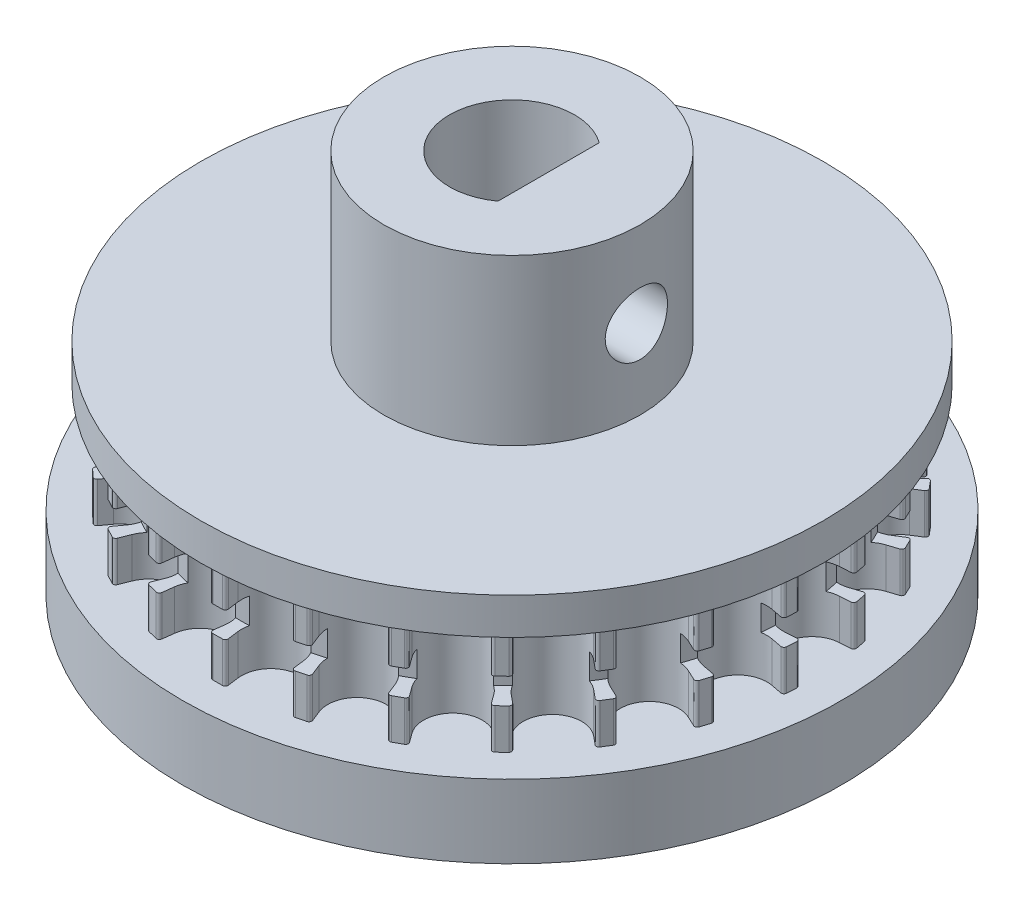
from build123d import *

# Parameters (mm, degrees)
SKETCH1_R           = 18
BOSS_EXTRUDE1_DEPTH = 4
BOSS_EXTRUDE4_DEPTH = 6
SKETCH8_R           = 17
BOSS_EXTRUDE5_DEPTH = 2
SKETCH9_R           = 7
BOSS_EXTRUDE6_DEPTH = 9
CUT_EXTRUDE3_DEPTH  = 34
F_3DSKETCH1_R       = 1.7
CUT_EXTRUDE4_DEPTH  = 9
SKETCH17_R          = 17.01674899
SKETCH17_R_2        = 14.83658427
CUT_EXTRUDE6_DEPTH  = 1.4


with BuildPart() as part:
    # Sketch1 → Boss-Extrude1 (new body)
    with BuildSketch(Plane(origin=(0, 0, 0), x_dir=(1, 0, 0), z_dir=(0, 1, 0))):
        Circle(SKETCH1_R)
    extrude(amount=BOSS_EXTRUDE1_DEPTH)

    # Sketch7 → Boss-Extrude4 (add)
    with BuildSketch(Plane(origin=(0, 4, 0), x_dir=(1, 0, 0), z_dir=(0, 1, 0))):
        with BuildLine():
            Line((2.150018016, 15.28671265), (2.299143935, 15.867519758))
            ThreePointArc((2.299143935, 15.867519758), (2.278294144, 15.98858041), (2.173985961, 16.053466449))
            Line((2.173985961, 16.053466449), (1.646061715, 16.116155895))
            ThreePointArc((1.646061715, 16.116155895), (1.530287316, 16.078256523), (1.480820403, 15.966932229))
            Line((1.480820403, 15.966932229), (1.480820403, 15.3411402))
            ThreePointArc((1.480820403, 15.3411402), (-0.119179597, 13.7411402), (-1.719179597, 15.3411402))
            Line((-1.719179597, 15.3411402), (-1.719179597, 15.940786293))
            ThreePointArc((-1.719179597, 15.940786293), (-1.769480914, 16.052858469), (-1.886648566, 16.089765604))
            Line((-1.886648566, 16.089765604), (-2.413577332, 16.019196124))
            ThreePointArc((-2.413577332, 16.019196124), (-2.516289275, 15.953695509), (-2.536516868, 15.833566751))
            Line((-2.536516868, 15.833566751), (-2.380888719, 15.227435129))
            ThreePointArc((-2.380888719, 15.227435129), (-3.532717957, 13.279798252), (-5.480354834, 14.43162749))
            Line((-5.480354834, 14.43162749), (-5.629480753, 15.012434598))
            ThreePointArc((-5.629480753, 15.012434598), (-5.706072979, 15.108476392), (-5.828738024, 15.115085612))
            Line((-5.828738024, 15.115085612), (-6.321562438, 14.915691346))
            ThreePointArc((-6.321562438, 14.915691346), (-6.404758156, 14.826705131), (-6.394475455, 14.705320042))
            Line((-6.394475455, 14.705320042), (-6.092997846, 14.156934306))
            ThreePointArc((-6.092997846, 14.156934306), (-6.724282655, 11.98403774), (-8.897179222, 12.615322549))
            Line((-8.897179222, 12.615322549), (-9.18606093, 13.140796426))
            ThreePointArc((-9.18606093, 13.140796426), (-9.284131493, 13.214773178), (-9.404586436, 13.190669201))
            Line((-9.404586436, 13.190669201), (-9.832340528, 12.874978825))
            ThreePointArc((-9.832340528, 12.874978825), (-9.890792527, 12.768098342), (-9.850645632, 12.653083992))
            Line((-9.850645632, 12.653083992), (-9.422261509, 12.196901236))
            ThreePointArc((-9.422261509, 12.196901236), (-9.493335944, 9.935276062), (-11.754961117, 10.006350497))
            Line((-11.754961117, 10.006350497), (-12.165447114, 10.443473686))
            ThreePointArc((-12.165447114, 10.443473686), (-12.27883388, 10.490737165), (-12.389510095, 10.437434532))
            Line((-12.389510095, 10.437434532), (-12.725316501, 10.025284033))
            ThreePointArc((-12.725316501, 10.025284033), (-12.755352028, 9.907224976), (-12.687863516, 9.805808141))
            Line((-12.687863516, 9.805808141), (-12.15948983, 9.470492003))
            ThreePointArc((-12.15948983, 9.470492003), (-11.665888021, 7.262244451), (-13.874135574, 6.768642642))
            Line((-13.874135574, 6.768642642), (-14.380433515, 7.089949086))
            ThreePointArc((-14.380433515, 7.089949086), (-14.502011976, 7.107529554), (-14.595955268, 7.028377466))
            Line((-14.595955268, 7.028377466), (-14.818714038, 6.545663776))
            ThreePointArc((-14.818714038, 6.545663776), (-14.81844585, 6.423844229), (-14.727856272, 6.3423973))
            Line((-14.727856272, 6.3423973), (-14.132692685, 6.149016928))
            ThreePointArc((-14.132692685, 6.149016928), (-13.10542945, 4.132899311), (-15.121547067, 3.105636076))
            Line((-15.121547067, 3.105636076), (-15.691844391, 3.290936909))
            ThreePointArc((-15.691844391, 3.290936909), (-15.813975326, 3.277729721), (-15.885282892, 3.177701595))
            Line((-15.885282892, 3.177701595), (-15.980997272, 2.654755389))
            ThreePointArc((-15.980997272, 2.654755389), (-15.950442221, 2.536829723), (-15.842443653, 2.480470312))
            Line((-15.842443653, 2.480470312), (-15.217886482, 2.441176505))
            ThreePointArc((-15.217886482, 2.441176505), (-13.721508548, 0.743868908), (-15.418816144, -0.752509026))
            Line((-15.418816144, -0.752509026), (-16.017278972, -0.714856936))
            ThreePointArc((-16.017278972, -0.714856936), (-16.132288445, -0.758021925), (-16.17647977, -0.872640954))
            Line((-16.17647977, -0.872640954), (-16.139135674, -1.402961041))
            ThreePointArc((-16.139135674, -1.402961041), (-16.080213646, -1.509583124), (-15.961592036, -1.537313749))
            Line((-15.961592036, -1.537313749), (-15.346884504, -1.420052016))
            ThreePointArc((-15.346884504, -1.420052016), (-13.475414799, -2.691901514), (-14.747264297, -4.563371218))
            Line((-14.747264297, -4.563371218), (-15.336289009, -4.675733691))
            ThreePointArc((-15.336289009, -4.675733691), (-15.436950552, -4.746144265), (-15.451248932, -4.868152263))
            Line((-15.451248932, -4.868152263), (-15.283192826, -5.37252427))
            ThreePointArc((-15.283192826, -5.37252427), (-15.199606108, -5.461143311), (-15.077814888, -5.458502733))
            Line((-15.077814888, -5.458502733), (-14.511581331, -5.192053446))
            ThreePointArc((-14.511581331, -5.192053446), (-12.38261118, -5.958529864), (-13.149087598, -8.087500014))
            Line((-13.149087598, -8.087500014), (-13.691663604, -8.342816903))
            ThreePointArc((-13.691663604, -8.342816903), (-13.771652282, -8.436048907), (-13.755159297, -8.557779661))
            Line((-13.755159297, -8.557779661), (-13.466950765, -9.00451204))
            ThreePointArc((-13.466950765, -9.00451204), (-13.363951418, -9.069559779), (-13.246643178, -9.036713915))
            Line((-13.246643178, -9.036713915), (-12.764462133, -8.637819063))
            ThreePointArc((-12.764462133, -8.637819063), (-10.511762561, -8.850761868), (-10.724705365, -11.10346144))
            Line((-10.724705365, -11.10346144), (-11.186740621, -11.485690245))
            ThreePointArc((-11.186740621, -11.485690245), (-11.24103045, -11.595885569), (-11.194782415, -11.70969029))
            Line((-11.194782415, -11.70969029), (-10.80453066, -12.070713203))
            ThreePointArc((-10.80453066, -12.070713203), (-10.688590511, -12.108102451), (-10.58313616, -12.047115128))
            Line((-10.58313616, -12.047115128), (-10.215304834, -11.540838741))
            ThreePointArc((-10.215304834, -11.540838741), (-7.98042124, -11.186867954), (-7.626450452, -13.421751548))
            Line((-7.626450452, -13.421751548), (-7.978913582, -13.906875428))
            ThreePointArc((-7.978913582, -13.906875428), (-8.004093334, -14.027110095), (-7.930996183, -14.125838012))
            Line((-7.930996183, -14.125838012), (-7.463222157, -14.378467062))
            ThreePointArc((-7.463222157, -14.378467062), (-7.341626153, -14.385848516), (-7.254651775, -14.30055179))
            Line((-7.254651775, -14.30055179), (-7.024282364, -13.718705076))
            ThreePointArc((-7.024282364, -13.718705076), (-4.947640702, -12.820061983), (-4.048997609, -14.896703645))
            Line((-4.048997609, -14.896703645), (-4.269742059, -15.454240482))
            ThreePointArc((-4.269742059, -15.454240482), (-4.264229597, -15.576959706), (-4.168876292, -15.654407381))
            Line((-4.168876292, -15.654407381), (-3.652971957, -15.782768955))
            ThreePointArc((-3.652971957, -15.782768955), (-3.533360423, -15.759678811), (-3.470330938, -15.65543219))
            Line((-3.470330938, -15.65543219), (-3.391898399, -15.034574718))
            ThreePointArc((-3.391898399, -15.034574718), (-1.603981703, -13.64772437), (-0.217131355, -15.435641065))
            Line((-0.217131355, -15.435641065), (-0.292286939, -16.03055877))
            ThreePointArc((-0.292286939, -16.03055877), (-0.256428631, -16.14805165), (-0.144810572, -16.199352762))
            Line((-0.144810572, -16.199352762), (0.386807904, -16.195381429))
            ThreePointArc((0.386807904, -16.195381429), (0.496919337, -16.143270526), (0.532043555, -16.026624209))
            Line((0.532043555, -16.026624209), (0.453611016, -15.405766737))
            ThreePointArc((0.453611016, -15.405766737), (1.840461365, -13.617850041), (3.628378061, -15.004700389))
            Line((3.628378061, -15.004700389), (3.703533644, -15.599618094))
            ThreePointArc((3.703533644, -15.599618094), (3.767484689, -15.70450212), (3.888354129, -15.726433231))
            Line((3.888354129, -15.726433231), (4.402283203, -15.590378527))
            ThreePointArc((4.402283203, -15.590378527), (4.495975828, -15.512521183), (4.500987794, -15.390804487))
            Line((4.500987794, -15.390804487), (4.270618384, -14.808957773))
            ThreePointArc((4.270618384, -14.808957773), (5.169261477, -12.732316111), (7.245903138, -13.630959204))
            Line((7.245903138, -13.630959204), (7.466647588, -14.188496041))
            ThreePointArc((7.466647588, -14.188496041), (7.55467309, -14.274180965), (7.677199239, -14.265364063))
            Line((7.677199239, -14.265364063), (8.141146858, -14.005774803))
            ThreePointArc((8.141146858, -14.005774803), (8.212533622, -13.907063083), (8.187118417, -13.787923915))
            Line((8.187118417, -13.787923915), (7.819287092, -13.281647529))
            ThreePointArc((7.819287092, -13.281647529), (8.173257879, -11.046763934), (10.408141474, -11.400734722))
            Line((10.408141474, -11.400734722), (10.760604604, -11.885858601))
            ThreePointArc((10.760604604, -11.885858601), (10.867173596, -11.946960524), (10.983657687, -11.907949606))
            Line((10.983657687, -11.907949606), (11.368472314, -11.54113674))
            ThreePointArc((11.368472314, -11.54113674), (11.413067726, -11.427773063), (11.35882228, -11.318697376))
            Line((11.35882228, -11.318697376), (10.876641234, -10.919802524))
            ThreePointArc((10.876641234, -10.919802524), (10.663698429, -8.667102952), (12.916398001, -8.454160147))
            Line((12.916398001, -8.454160147), (13.378433257, -8.836388952))
            ThreePointArc((13.378433257, -8.836388952), (13.496849619, -8.869068615), (13.599972527, -8.802314881))
            Line((13.599972527, -8.802314881), (13.881474845, -8.351326609))
            ThreePointArc((13.881474845, -8.351326609), (13.89647681, -8.230434033), (13.816809564, -8.138275453))
            Line((13.816809564, -8.138275453), (13.250576007, -7.871826166))
            ThreePointArc((13.250576007, -7.871826166), (12.484099589, -5.742856016), (14.61306974, -4.976379598))
            Line((14.61306974, -4.976379598), (15.155645746, -5.231696487))
            ThreePointArc((15.155645746, -5.231696487), (15.278468942, -5.233900506), (15.361751076, -5.14359834))
            Line((15.361751076, -5.14359834), (15.522253258, -4.636771914))
            ThreePointArc((15.522253258, -4.636771914), (15.506719148, -4.515946564), (15.406635888, -4.446495753))
            Line((15.406635888, -4.446495753), (14.791928356, -4.32923402))
            ThreePointArc((14.791928356, -4.32923402), (13.520078859, -2.457764316), (15.391548563, -1.185914818))
            Line((15.391548563, -1.185914818), (15.980573275, -1.298277291))
            ThreePointArc((15.980573275, -1.298277291), (16.100085871, -1.26986718), (16.158294308, -1.161690598))
            Line((16.158294308, -1.161690598), (16.187711413, -0.630871787))
            ThreePointArc((16.187711413, -0.630871787), (16.142617292, -0.517705563), (16.028406618, -0.475326372))
            Line((16.028406618, -0.475326372), (15.403849447, -0.514620178))
            ThreePointArc((15.403849447, -0.514620178), (13.70654185, 0.981757756), (15.202919784, 2.679065353))
            Line((15.202919784, 2.679065353), (15.801382612, 2.716717442))
            ThreePointArc((15.801382612, 2.716717442), (15.910075194, 2.773956571), (15.939552483, 2.893210437))
            Line((15.939552483, 2.893210437), (15.836036125, 3.414668335))
            ThreePointArc((15.836036125, 3.414668335), (15.764215424, 3.513064782), (15.643053612, 3.525709514))
            Line((15.643053612, 3.525709514), (15.047890025, 3.332329142))
            ThreePointArc((15.047890025, 3.332329142), (13.031772408, 4.359592377), (14.059035643, 6.375709994))
            Line((14.059035643, 6.375709994), (14.629332967, 6.561010827))
            ThreePointArc((14.629332967, 6.561010827), (14.720375978, 6.643482429), (14.719269954, 6.766320419))
            Line((14.719269954, 6.766320419), (14.489324447, 7.245652288))
            ThreePointArc((14.489324447, 7.245652288), (14.395289924, 7.323096347), (14.274790016, 7.305212103))
            Line((14.274790016, 7.305212103), (13.74641633, 6.969895966))
            ThreePointArc((13.74641633, 6.969895966), (11.538168777, 7.463497775), (12.031770586, 9.671745328))
            Line((12.031770586, 9.671745328), (12.538068528, 9.993051772))
            ThreePointArc((12.538068528, 9.993051772), (12.605741402, 10.095573853), (12.57412156, 10.214277605))
            Line((12.57412156, 10.214277605), (12.232195225, 10.621365259))
            ThreePointArc((12.232195225, 10.621365259), (12.121855415, 10.672990836), (12.009588864, 10.62570135))
            Line((12.009588864, 10.62570135), (11.581204742, 10.169518594))
            ThreePointArc((11.581204742, 10.169518594), (9.319579569, 10.098444159), (9.248505134, 12.360069333))
            Line((9.248505134, 12.360069333), (9.658991132, 12.797192522))
            ThreePointArc((9.658991132, 12.797192522), (9.699041733, 12.913323243), (9.638894864, 13.020434163))
            Line((9.638894864, 13.020434163), (9.206472191, 13.329698789))
            ThreePointArc((9.206472191, 13.329698789), (9.08676015, 13.352262058), (8.989781076, 13.278538703))
            Line((8.989781076, 13.278538703), (8.688303467, 12.730152967))
            ThreePointArc((8.688303467, 12.730152967), (6.5154069, 12.098868158), (5.884122091, 14.271764724))
            Line((5.884122091, 14.271764724), (6.173003799, 14.797238601))
            ThreePointArc((6.173003799, 14.797238601), (6.182915602, 14.919681042), (6.098020954, 15.008468957))
            Line((6.098020954, 15.008468957), (5.60227265, 15.20047832))
            ThreePointArc((5.60227265, 15.20047832), (5.480710326, 15.192561549), (5.405112281, 15.097036633))
            Line((5.405112281, 15.097036633), (5.249484132, 14.490905011))
            ThreePointArc((5.249484132, 14.490905011), (3.301847255, 13.339075773), (2.150018016, 15.28671265))
        make_face()
    extrude(amount=BOSS_EXTRUDE4_DEPTH)

    # Sketch8 → Boss-Extrude5 (add)
    with BuildSketch(Plane(origin=(0, 10, 0), x_dir=(1, 0, 0), z_dir=(0, 1, 0))):
        Circle(SKETCH8_R)
    extrude(amount=BOSS_EXTRUDE5_DEPTH)

    # Sketch9 → Boss-Extrude6 (add)
    with BuildSketch(Plane(origin=(0, 12, 0), x_dir=(1, 0, 0), z_dir=(0, 1, 0))):
        Circle(SKETCH9_R)
    extrude(amount=BOSS_EXTRUDE6_DEPTH)

    # Sketch10 → Cut-Extrude3 (cut, through all)
    with BuildSketch(Plane(origin=(0, 21, 0), x_dir=(1, 0, 0), z_dir=(0, 1, 0))):
        with BuildLine():
            Line((2, -2.764129605), (2, 0))
            Line((2, 0), (2, 2.764129605))
            ThreePointArc((2, 2.764129605), (-3.41180487, 0), (2, -2.764129605))
        make_face()
    extrude(amount=-CUT_EXTRUDE3_DEPTH, mode=Mode.SUBTRACT)

    # 3DSketch1 → Cut-Extrude4 (cut)
    with BuildSketch(Plane(origin=(0, 16.3270116, 0), x_dir=(0, 0, 1), z_dir=(1, 0, 0))):
        Circle(F_3DSKETCH1_R)
    extrude(amount=CUT_EXTRUDE4_DEPTH, mode=Mode.SUBTRACT)

    # Sketch17 → Cut-Extrude6 (cut)
    with BuildSketch(Plane(origin=(0, 7.6, 0), x_dir=(1, 0, 0), z_dir=(0, 1, 0))):
        Circle(SKETCH17_R)
        Circle(SKETCH17_R_2, mode=Mode.SUBTRACT)
    extrude(amount=-CUT_EXTRUDE6_DEPTH, mode=Mode.SUBTRACT)


solid = part.part
